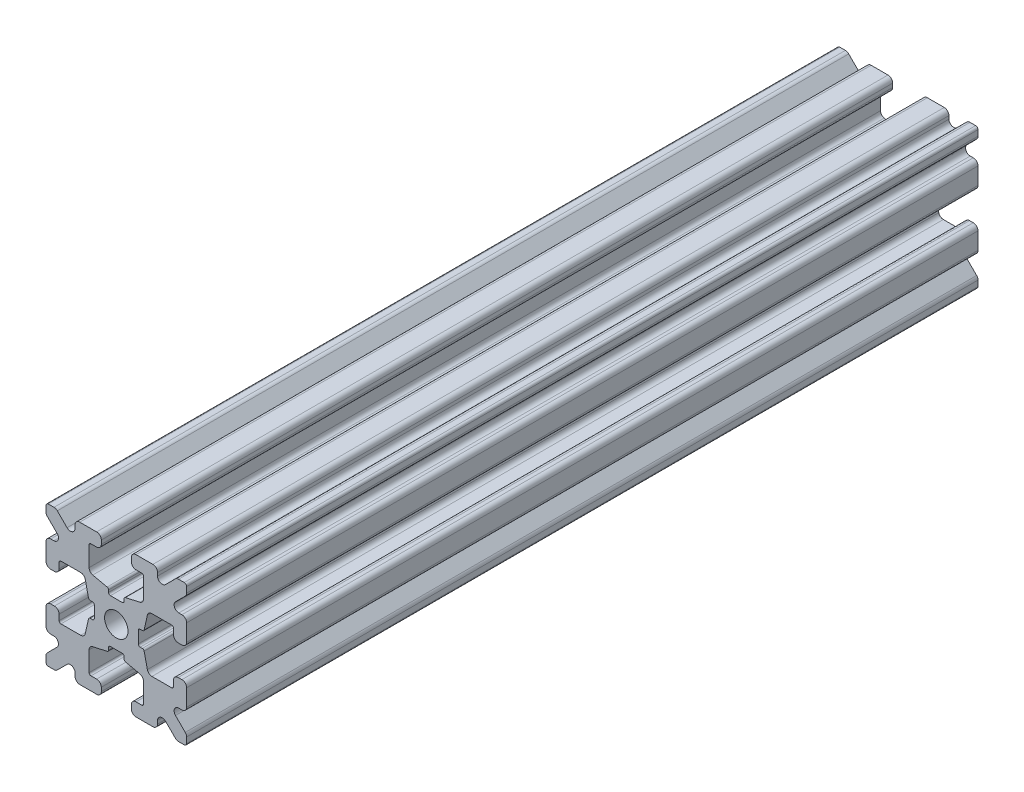
from build123d import *

# Parameters (mm, degrees)
SKETCH1_W           = 15
SKETCH1_H           = 15
SKETCH1_R           = 1.25
BOSS_EXTRUDE1_DEPTH = 42.21402
FILLET1_R           = 0.25
CUT_EXTRUDE1_DEPTH  = 86.091679606
CUT_EXTRUDE3_DEPTH  = 86.091679606
FILLET3_R           = 0.5
FILLET4_R           = 0.5
FILLET5_R           = 3
FILLET6_R           = 0.2
CUT_EXTRUDE4_DEPTH  = 86.091679606
FILLET8_R           = 0.5
SKETCH6_W           = 5.1529354
SKETCH6_H           = 1.651
SKETCH6_W_2         = 1.651
SKETCH6_H_2         = 5.1529354
CUT_EXTRUDE5_DEPTH  = 86.091679606
FILLET10_R          = 0.2


with BuildPart() as part:
    # Sketch1 → Boss-Extrude1 (new, symmetric)
    with BuildSketch(Plane.XY):
        Rectangle(SKETCH1_W, SKETCH1_H)
        Circle(SKETCH1_R, mode=Mode.SUBTRACT)
    extrude(amount=BOSS_EXTRUDE1_DEPTH, both=True)

    # Fillet1
    fillet1_edges = [part.edges().sort_by_distance(p)[0] for p in [
        (7.5, -7.5, 0),
        (-7.5, -7.5, 0),
        (7.5, 7.5, 0),
        (-7.5, 7.5, 0),
    ]]
    fillet(fillet1_edges, radius=FILLET1_R)

    # Sketch2 → Cut-Extrude1 (cut, through all)
    with BuildSketch(Plane.XY.offset(42.21402)):
        Polygon((-7.5, 1.6), (-6.1, 1.6), (-6.1, 2.9), (-3.4, 2.9), (-3.4, -2.9), (-6.1, -2.9), (-6.1, -1.6), (-7.5, -1.6), align=None)
        Polygon((2.9, 6.1), (1.6, 6.1), (1.6, 7.5), (-1.6, 7.5), (-1.6, 6.1), (-2.9, 6.1), (-2.9, 3.4), (2.9, 3.4), align=None)
        Polygon((-1.6, -7.5), (-1.6, -6.1), (-2.9, -6.1), (-2.9, -3.4), (2.9, -3.4), (2.9, -6.1), (1.6, -6.1), (1.6, -7.5), align=None)
        Polygon((6.1, -2.9), (6.1, -1.6), (7.5, -1.6), (7.5, 1.6), (6.1, 1.6), (6.1, 2.9), (3.4, 2.9), (3.4, -2.9), align=None)
    extrude(amount=-CUT_EXTRUDE1_DEPTH, mode=Mode.SUBTRACT)

    # Sketch4 → Cut-Extrude3 (cut, through all)
    with BuildSketch(Plane.XY.offset(42.21402)):
        Polygon((-3.4, 2.9), (-2.75, 0), (-3.4, -2.9), align=None)
        Polygon((-2.9, 3.4), (0, 2.75), (2.9, 3.4), align=None)
        Polygon((3.4, 2.9), (2.75, 0), (3.4, -2.9), align=None)
        Polygon((-2.9, -3.4), (0, -2.75), (2.9, -3.4), align=None)
    extrude(amount=-CUT_EXTRUDE3_DEPTH, mode=Mode.SUBTRACT)

    # Fillet3
    fillet3_edges = [part.edges().sort_by_distance(p)[0] for p in [
        (-6.1, -1.6, 0),
        (-7.5, -1.6, 0),
        (-6.1, 1.6, 0),
        (-7.5, 1.6, 0),
        (-1.6, -7.5, 0),
        (-1.6, -6.1, 0),
        (1.6, -7.5, 0),
        (1.6, -6.1, 0),
        (6.1, -1.6, 0),
        (7.5, -1.6, 0),
        (7.5, 1.6, 0),
        (6.1, 1.6, 0),
        (1.6, 7.5, 0),
        (1.6, 6.1, 0),
        (-1.6, 7.5, 0),
        (-1.6, 6.1, 0),
    ]]
    fillet(fillet3_edges, radius=FILLET3_R)

    # Fillet4
    fillet4_edges = [part.edges().sort_by_distance(p)[0] for p in [
        (-3.4, 2.9, 0),
        (-3.4, -2.9, 0),
        (2.9, -3.4, 0),
        (-2.9, -3.4, 0),
        (3.4, -2.9, 0),
        (3.4, 2.9, 0),
        (-2.9, 3.4, 0),
        (2.9, 3.4, 0),
    ]]
    fillet(fillet4_edges, radius=FILLET4_R)

    # Fillet5
    fillet5_edges = [part.edges().sort_by_distance(p)[0] for p in [
        (0, -2.75, 0),
        (2.75, 0, 0),
        (-2.75, 0, 0),
        (0, 2.75, 0),
    ]]
    fillet(fillet5_edges, radius=FILLET5_R)

    # Fillet6
    fillet6_edges = [part.edges().sort_by_distance(p)[0] for p in [
        (-2.9, -6.1, 0),
        (2.9, -6.1, 0),
        (6.1, -2.9, 0),
        (6.1, 2.9, 0),
        (2.9, 6.1, 0),
        (-2.9, 6.1, 0),
        (-6.1, -2.9, 0),
        (-6.1, 2.9, 0),
    ]]
    fillet(fillet6_edges, radius=FILLET6_R)

    # Sketch5 → Cut-Extrude4 (cut, through all)
    with BuildSketch(Plane.XY.offset(42.21402)):
        Polygon((-7.5, 6.439339828), (-5.460660172, 4.4), (-7.5, 4.4), align=None)
        Polygon((-6.439339828, 7.5), (-4.4, 5.460660172), (-4.4, 7.5), align=None)
        Polygon((4.4, 7.5), (6.439339828, 7.5), (4.4, 5.460660172), align=None)
        Polygon((7.5, 6.439339828), (7.5, 4.4), (5.460660172, 4.4), align=None)
        Polygon((7.5, -6.439339828), (5.460660172, -4.4), (7.5, -4.4), align=None)
        Polygon((6.439339828, -7.5), (4.4, -5.460660172), (4.4, -7.5), align=None)
        Polygon((-4.4, -7.5), (-6.439339828, -7.5), (-4.4, -5.460660172), align=None)
        Polygon((-7.5, -6.439339828), (-7.5, -4.4), (-5.460660172, -4.4), align=None)
    extrude(amount=-CUT_EXTRUDE4_DEPTH, mode=Mode.SUBTRACT)

    # Fillet8
    fillet8_edges = [part.edges().sort_by_distance(p)[0] for p in [
        (-5.460660172, 4.4, 0),
        (-7.5, 4.4, 0),
        (-5.460660172, -4.4, 0),
        (-7.5, -4.4, 0),
        (-4.4, -7.5, 0),
        (-4.4, -5.460660172, 0),
        (4.4, -7.5, 0),
        (4.4, -5.460660172, 0),
        (5.460660172, -4.4, 0),
        (7.5, -4.4, 0),
        (7.5, 4.4, 0),
        (5.460660172, 4.4, 0),
        (4.4, 5.460660172, 0),
        (4.4, 7.5, 0),
        (-4.4, 5.460660172, 0),
        (-4.4, 7.5, 0),
        (-6.439339828, 7.5, 0),
        (-7.5, 6.439339828, 0),
        (6.439339828, 7.5, 0),
        (7.5, 6.439339828, 0),
        (6.439339828, -7.5, 0),
        (7.5, -6.439339828, 0),
        (-6.439339828, -7.5, 0),
        (-7.5, -6.439339828, 0),
    ]]
    fillet(fillet8_edges, radius=FILLET8_R)

    # Sketch6 → Cut-Extrude5 (cut, through all)
    with BuildSketch(Plane.XY.offset(42.21402)):
        with Locations((4.9235323, 0)):
            Rectangle(SKETCH6_W, SKETCH6_H)
        with Locations((0, -4.9235323)):
            Rectangle(SKETCH6_W_2, SKETCH6_H_2)
        with Locations((-4.9235323, 0)):
            Rectangle(SKETCH6_W, SKETCH6_H)
        with Locations((0, 4.9235323)):
            Rectangle(SKETCH6_W_2, SKETCH6_H_2)
    extrude(amount=-CUT_EXTRUDE5_DEPTH, mode=Mode.SUBTRACT)

    # Fillet10
    fillet10_edges = [part.edges().sort_by_distance(p)[0] for p in [
        (-2.935025862, 0.8255, 0),
        (-2.935025862, -0.8255, 0),
        (2.935025862, -0.8255, 0),
        (2.935025862, 0.8255, 0),
        (0.8255, 2.935025862, 0),
        (-0.8255, 2.935025862, 0),
        (-2.3470646, 0.8255, 0),
        (-2.3470646, -0.8255, 0),
        (0.8255, 2.3470646, 0),
        (-0.8255, 2.3470646, 0),
        (2.3470646, 0.8255, 0),
        (2.3470646, -0.8255, 0),
        (0.8255, -2.935025862, 0),
        (0.8255, -2.3470646, 0),
        (-0.8255, -2.3470646, 0),
        (-0.8255, -2.935025862, 0),
    ]]
    fillet(fillet10_edges, radius=FILLET10_R)


solid = part.part
